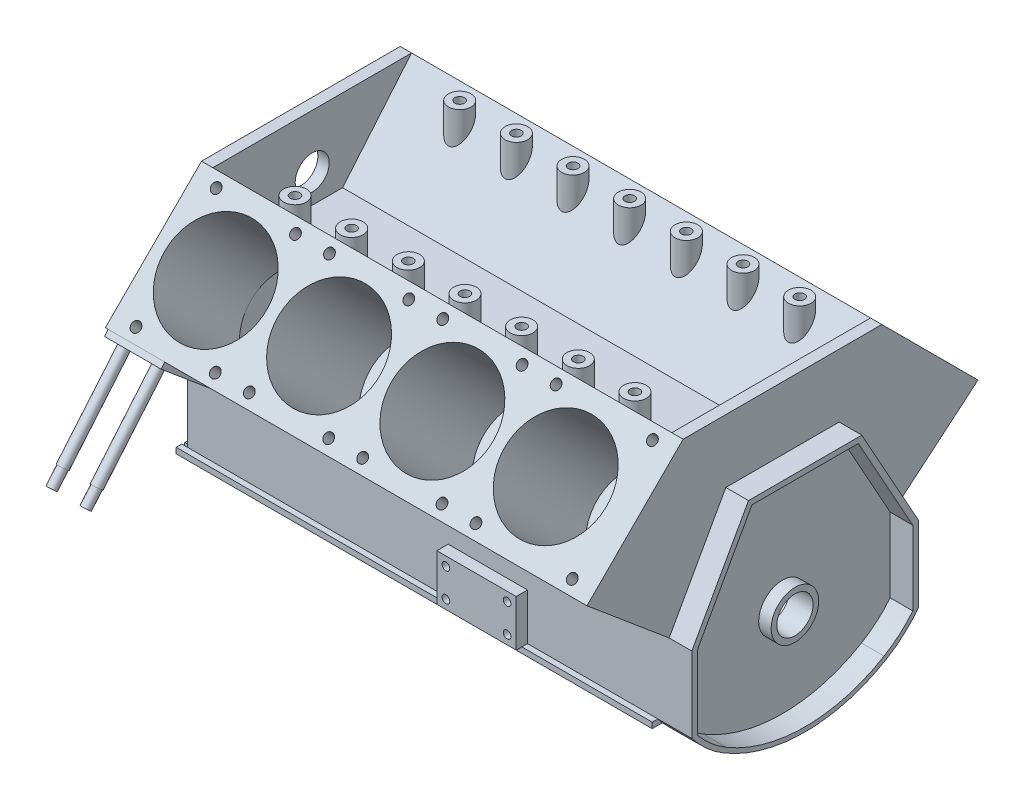
from build123d import *
from build123d.topology import SkipClean

# Parameters (mm, degrees)
BOSS_EXTRUDE1_DEPTH               = 255
BOSS_EXTRUDE1_DEPTH_BACK          = 170
SKETCH1_R                         = 16
CUT_EXTRUDE1_DEPTH                = 245
CUT_EXTRUDE1_DEPTH_BACK           = 160
SKETCH27_W                        = 15
SKETCH27_H                        = 300
BOSS_EXTRUDE10_DEPTH              = 140
BOSS_EXTRUDE10_2_DEPTH            = 140
BOSS_EXTRUDE10_3_DEPTH            = 140
SPLIT1_START                      = -150
SPLIT1_OUTLINE_W                  = 15
SPLIT1_OUTLINE_H                  = 140
SPLIT1_DEPTH                      = 50
SPLIT1_START_2                    = 100
SPLIT1_2_OUTLINE_W                = 15
SPLIT1_2_OUTLINE_H                = 140
SPLIT1_2_DEPTH                    = 50
SPLIT1_3_OUTLINE_W                = 15
SPLIT1_3_OUTLINE_H                = 140
SPLIT1_3_DEPTH                    = 50
SPLIT1_4_OUTLINE_W                = 15
SPLIT1_4_OUTLINE_H                = 140
SPLIT1_4_DEPTH                    = 50
SPLIT1_5_OUTLINE_W                = 15
SPLIT1_5_OUTLINE_H                = 140
SPLIT1_5_DEPTH                    = 50
SPLIT1_6_OUTLINE_W                = 15
SPLIT1_6_OUTLINE_H                = 140
SPLIT1_6_DEPTH                    = 50
SKETCH16_R                        = 21
SKETCH16_R_2                      = 16
BOSS_EXTRUDE5_DEPTH               = 11
BOSS_EXTRUDE6_DEPTH               = 10
BOSS_EXTRUDE7_START               = 5
SKETCH21_R                        = 22.5
SKETCH21_R_2                      = 16
BOSS_EXTRUDE7_DEPTH               = 5
CUT_EXTRUDE2_DEPTH                = 30
CUT_EXTRUDE2_DEPTH_BACK           = 20
BOSS_EXTRUDE8_DEPTH               = 5
BOSS_EXTRUDE12_DEPTH              = 5
CUT_EXTRUDE3_START                = 405
CUT_EXTRUDE3_DEPTH                = 405
TAP_DRILL_FOR_M8_TAP1_D           = 6.8
TAP_DRILL_FOR_M8_TAP1_DEPTH       = 10
TAP_DRILL_FOR_M8_TAP1_TIP         = 2.042926105
TAP_DRILL_FOR_M6_TAP1_D           = 5
TAP_DRILL_FOR_M6_TAP1_DEPTH       = 10
TAP_DRILL_FOR_M6_TAP1_TIP         = 1.502151548
SKETCH36_W                        = 175.362481734
SKETCH36_H                        = 92.53405461
BOSS_EXTRUDE13_DEPTH              = 10
SKETCH37_W                        = 175.362481734
SKETCH37_H                        = 92.53405461
SKETCH37_R                        = 15
BOSS_EXTRUDE14_DEPTH              = 10
TAP_DRILL_FOR_M5_TAP1_D           = 4.2
TAP_DRILL_FOR_M5_TAP1_DEPTH       = 10
TAP_DRILL_FOR_M5_TAP1_TIP         = 1.2618073
TAP_DRILL_FOR_M10_TAP1_D          = 8.5
TAP_DRILL_FOR_M10_TAP1_DEPTH      = 40
TAP_DRILL_FOR_M10_TAP1_TIP        = 2.553657631
TAP_DRILL_FOR_M10_TAP2_D          = 8.5
TAP_DRILL_FOR_M10_TAP2_DEPTH      = 40
TAP_DRILL_FOR_M10_TAP2_TIP        = 2.553657631
BOSS_EXTRUDE15_REACH              = 410.47
SKETCH47_R                        = 10
BOSS_EXTRUDE16_REACH              = 410.47
SKETCH52_R                        = 10
TAP_DRILL_FOR_M10_TAP4_AT_2_COUNT = 2
TAP_DRILL_FOR_M10_TAP4_AT_2_PITCH = 50
TAP_DRILL_FOR_M10_TAP4_AT_3_COUNT = 2
TAP_DRILL_FOR_M10_TAP4_AT_3_PITCH = 100
TAP_DRILL_FOR_M10_TAP4_AT_4_COUNT = 2
TAP_DRILL_FOR_M10_TAP4_AT_4_PITCH = 150
TAP_DRILL_FOR_M10_TAP4_AT_5_COUNT = 2
TAP_DRILL_FOR_M10_TAP4_AT_5_PITCH = 200
TAP_DRILL_FOR_M10_TAP4_AT_6_COUNT = 2
TAP_DRILL_FOR_M10_TAP4_AT_6_PITCH = 250
TAP_DRILL_FOR_M10_TAP4_AT_7_COUNT = 2
TAP_DRILL_FOR_M10_TAP4_AT_7_PITCH = 300
BOSS_EXTRUDE17_START              = 20
BOSS_EXTRUDE17_DEPTH              = 20
SKETCH54_R                        = 10
BOSS_EXTRUDE18_DEPTH              = 5
SKETCH55_R                        = 5
BOSS_EXTRUDE19_DEPTH              = 15
SKETCH56_W                        = 2.5
SKETCH56_H                        = 15.374670197
CUT_EXTRUDE4_DEPTH                = 508.504679815
TAP_DRILL_FOR_M6_TAP2_D           = 5
TAP_DRILL_FOR_M6_TAP2_DEPTH       = 10
TAP_DRILL_FOR_M6_TAP2_TIP         = 1.502151548
SKETCH60_W                        = 50
SKETCH60_H                        = 65
BOSS_EXTRUDE20_DEPTH              = 5
SKETCH61_R                        = 4.5
BOSS_EXTRUDE21_DEPTH              = 100
SKETCH62_OUTSIDE_W                = 601.06
SKETCH62_OUTSIDE_H                = 614.412
SKETCH62_OUTSIDE_R                = 4
CUT_EXTRUDE5_DEPTH                = 15
SKETCH63_W                        = 50
SKETCH63_H                        = 45
BOSS_EXTRUDE22_DEPTH              = 2.5
SKETCH64_R                        = 5
BOSS_EXTRUDE23_DEPTH              = 80
SKETCH65_OUTSIDE_W                = 612.408
SKETCH65_OUTSIDE_H                = 615.467
SKETCH65_OUTSIDE_R                = 4
CUT_EXTRUDE6_DEPTH                = 20
SKETCH66_W                        = 70
SKETCH66_H                        = 41
BOSS_EXTRUDE24_DEPTH              = 10
TAP_DRILL_FOR_M8_TAP2_AT_2_COUNT  = 2
TAP_DRILL_FOR_M8_TAP2_AT_2_PITCH  = 54
TAP_DRILL_FOR_M8_TAP2_AT_3_COUNT  = 2
TAP_DRILL_FOR_M8_TAP2_AT_3_PITCH  = 59.506302187
TAP_DRILL_FOR_M8_TAP2_AT_4_COUNT  = 2
TAP_DRILL_FOR_M8_TAP2_AT_4_PITCH  = 25


# Read off the part's stored shape, not the designer's step: Split1
with BuildPart() as part:
    # Sketch1 → Boss-Extrude1 (new, two sides: drawn at the far end of the back side and taken through both)
    with BuildSketch(Plane(origin=(0, 0, 0), x_dir=(0, 0, -1), z_dir=(1, 0, 0)).offset(-BOSS_EXTRUDE1_DEPTH_BACK)):
        Polygon((-87.681240867, 172.53405461), (-172.53405461, 87.681240867), (-100, 26.817942396), (-100, -40), (100, -40), (100, 26.817942396), (172.53405461, 87.681240867), (87.681240867, 172.53405461), (26.817942396, 100), (-26.817942396, 100), align=None)
        Circle(SKETCH1_R, mode=Mode.SUBTRACT)
    extrude(amount=BOSS_EXTRUDE1_DEPTH + BOSS_EXTRUDE1_DEPTH_BACK)

    # Sketch2 → Cut-Extrude1 (cut, two sides: drawn at the far end of the back side and taken through both)
    with BuildSketch(Plane(origin=(0, 0, 0), x_dir=(0, 0, -1), z_dir=(1, 0, 0)).offset(-CUT_EXTRUDE1_DEPTH_BACK)):
        Polygon((-90, -50), (-90, 18.426946085), (-18.426946085, 90), (18.426946085, 90), (90, 18.426946085), (90, -50), align=None)
    extrude(amount=CUT_EXTRUDE1_DEPTH + CUT_EXTRUDE1_DEPTH_BACK, mode=Mode.SUBTRACT)


with BuildPart() as body_2:
    # Sketch27 → Boss-Extrude10 (new body)
    with BuildSketch(Plane.XZ.offset(40)):
        with Locations((-57.5, 0)):
            Rectangle(SKETCH27_W, SKETCH27_H)
    extrude(amount=-BOSS_EXTRUDE10_DEPTH)

    # Split1 outline → Split1 (cut)
    with BuildSketch(Plane.XY.offset(SPLIT1_START)):
        with Locations((-57.5, 30)):
            Rectangle(SPLIT1_OUTLINE_W, SPLIT1_OUTLINE_H)
    extrude(amount=SPLIT1_DEPTH, mode=Mode.SUBTRACT)

    # Split1 2 outline → Split1 2 (cut)
    with BuildSketch(Plane.XY.offset(SPLIT1_START_2)):
        with Locations((-57.5, 30)):
            Rectangle(SPLIT1_2_OUTLINE_W, SPLIT1_2_OUTLINE_H)
    extrude(amount=SPLIT1_2_DEPTH, mode=Mode.SUBTRACT)


with BuildPart() as body_3:
    # Sketch27 → Boss-Extrude10 2 (new body)
    with BuildSketch(Plane.XZ.offset(40)):
        with Locations((42.5, 0)):
            Rectangle(SKETCH27_W, SKETCH27_H)
    extrude(amount=-BOSS_EXTRUDE10_2_DEPTH)

    # Split1 3 outline → Split1 3 (cut)
    with BuildSketch(Plane.XY.offset(SPLIT1_START)):
        with Locations((42.5, 30)):
            Rectangle(SPLIT1_3_OUTLINE_W, SPLIT1_3_OUTLINE_H)
    extrude(amount=SPLIT1_3_DEPTH, mode=Mode.SUBTRACT)

    # Split1 4 outline → Split1 4 (cut)
    with BuildSketch(Plane.XY.offset(SPLIT1_START_2)):
        with Locations((42.5, 30)):
            Rectangle(SPLIT1_4_OUTLINE_W, SPLIT1_4_OUTLINE_H)
    extrude(amount=SPLIT1_4_DEPTH, mode=Mode.SUBTRACT)


with BuildPart() as body_4:
    # Sketch27 → Boss-Extrude10 3 (new body)
    with BuildSketch(Plane.XZ.offset(40)):
        with Locations((142.5, 0)):
            Rectangle(SKETCH27_W, SKETCH27_H)
    extrude(amount=-BOSS_EXTRUDE10_3_DEPTH)

    # Split1 5 outline → Split1 5 (cut)
    with BuildSketch(Plane.XY.offset(SPLIT1_START)):
        with Locations((142.5, 30)):
            Rectangle(SPLIT1_5_OUTLINE_W, SPLIT1_5_OUTLINE_H)
    extrude(amount=SPLIT1_5_DEPTH, mode=Mode.SUBTRACT)

    # Split1 6 outline → Split1 6 (cut)
    with BuildSketch(Plane.XY.offset(SPLIT1_START_2)):
        with Locations((142.5, 30)):
            Rectangle(SPLIT1_6_OUTLINE_W, SPLIT1_6_OUTLINE_H)
    extrude(amount=SPLIT1_6_DEPTH, mode=Mode.SUBTRACT)


with BuildPart() as part_1:
    add(part.part)

    # Combine1: union body 4, body 3, body 2
    add(body_4.part)
    add(body_3.part)
    add(body_2.part)

    # Sketch3 → Cut-Revolve1 (revolve, cut)
    with BuildSketch(Plane(origin=(-115, 0, 0), x_dir=(0, 0, -1), z_dir=(1, 0, 0)), mode=Mode.PRIVATE) as cut_revolve1_sk:
        Polygon((-98.287842585, 161.927452892), (-16.970562748, 80.610173055), (-48.790367902, 48.790367902), (-130.107647738, 130.107647738), align=None)
    revolve(cut_revolve1_sk.sketch.rotate(Axis((-115, 130.107647738, 130.107647738), (0, -0.7071067811865525, -0.7071067811865427)), 180), axis=Axis((-115, 130.107647738, 130.107647738), (0, -0.7071067811865525, -0.7071067811865427)), mode=Mode.SUBTRACT)

    # Sketch4 → Cut-Revolve2 (revolve, cut)
    with BuildSketch(Plane(origin=(-15, 0, 0), x_dir=(0, 0, -1), z_dir=(1, 0, 0)), mode=Mode.PRIVATE) as cut_revolve2_sk:
        Polygon((-98.287842585, 161.927452892), (-130.107647738, 130.107647738), (-48.790367902, 48.790367902), (-16.970562748, 80.610173055), align=None)
    revolve(cut_revolve2_sk.sketch.rotate(Axis((-15, 130.107647738, 130.107647738), (0, -0.7071067811865525, -0.7071067811865427)), 180), axis=Axis((-15, 130.107647738, 130.107647738), (0, -0.7071067811865525, -0.7071067811865427)), mode=Mode.SUBTRACT)

    # Sketch5 → Cut-Revolve3 (revolve, cut)
    with BuildSketch(Plane(origin=(85, 0, 0), x_dir=(0, 0, -1), z_dir=(1, 0, 0)), mode=Mode.PRIVATE) as cut_revolve3_sk:
        Polygon((-98.287842585, 161.927452892), (-130.107647738, 130.107647738), (-48.790367902, 48.790367902), (-16.970562748, 80.610173055), align=None)
    revolve(cut_revolve3_sk.sketch.rotate(Axis((85, 130.107647738, 130.107647738), (0, -0.7071067811865525, -0.7071067811865427)), 180), axis=Axis((85, 130.107647738, 130.107647738), (0, -0.7071067811865525, -0.7071067811865427)), mode=Mode.SUBTRACT)

    # Sketch6 → Cut-Revolve4 (revolve, cut)
    with BuildSketch(Plane(origin=(185, 0, 0), x_dir=(0, 0, -1), z_dir=(1, 0, 0))):
        Polygon((-16.970562748, 80.610173055), (-48.790367902, 48.790367902), (-130.107647738, 130.107647738), (-98.287842585, 161.927452892), align=None)
    revolve(axis=Axis((185, 48.790367902, 48.790367902), (0, 0.7071067811865525, 0.7071067811865427)), mode=Mode.SUBTRACT)

    # Sketch7 → Cut-Revolve5 (revolve, cut)
    with BuildSketch(Plane(origin=(0, 0, 0), x_dir=(0, 0, -1), z_dir=(1, 0, 0))):
        Polygon((130.107647738, 130.107647738), (48.790367902, 48.790367902), (16.970562748, 80.610173055), (98.287842585, 161.927452892), align=None)
    revolve(axis=Axis((0, 130.107647738, -130.107647738), (0, -0.7071067811865439, 0.7071067811865512)), mode=Mode.SUBTRACT)

    # Sketch8 → Cut-Revolve6 (revolve, cut)
    with BuildSketch(Plane(origin=(-100, 0, 0), x_dir=(0, 0, -1), z_dir=(1, 0, 0)), mode=Mode.PRIVATE) as cut_revolve6_sk:
        Polygon((130.107647738, 130.107647738), (98.287842585, 161.927452892), (16.970562748, 80.610173055), (48.790367902, 48.790367902), align=None)
    revolve(cut_revolve6_sk.sketch.rotate(Axis((-100, 48.790367902, -48.790367902), (0, 0.7071067811865439, -0.7071067811865512)), 180), axis=Axis((-100, 48.790367902, -48.790367902), (0, 0.7071067811865439, -0.7071067811865512)), mode=Mode.SUBTRACT)

    # Sketch9 → Cut-Revolve7 (revolve, cut)
    with BuildSketch(Plane(origin=(100, 0, 0), x_dir=(0, 0, -1), z_dir=(1, 0, 0)), mode=Mode.PRIVATE) as cut_revolve7_sk:
        Polygon((130.107647738, 130.107647738), (98.287842585, 161.927452892), (16.970562748, 80.610173055), (48.790367902, 48.790367902), align=None)
    revolve(cut_revolve7_sk.sketch.rotate(Axis((100, 48.790367902, -48.790367902), (0, 0.7071067811865439, -0.7071067811865512)), 180), axis=Axis((100, 48.790367902, -48.790367902), (0, 0.7071067811865439, -0.7071067811865512)), mode=Mode.SUBTRACT)

    # Sketch10 → Cut-Revolve8 (revolve, cut)
    with BuildSketch(Plane(origin=(200, 0, 0), x_dir=(0, 0, -1), z_dir=(1, 0, 0)), mode=Mode.PRIVATE) as cut_revolve8_sk:
        Polygon((130.107647738, 130.107647738), (98.287842585, 161.927452892), (16.970562748, 80.610173055), (48.790367902, 48.790367902), align=None)
    revolve(cut_revolve8_sk.sketch.rotate(Axis((200, 48.790367902, -48.790367902), (0, 0.7071067811865439, -0.7071067811865512)), 180), axis=Axis((200, 48.790367902, -48.790367902), (0, 0.7071067811865439, -0.7071067811865512)), mode=Mode.SUBTRACT)

    # Sketch16 → Boss-Extrude5 (add)
    with BuildSketch(Plane.ZY.offset(-255)):
        Circle(SKETCH16_R)
        Circle(SKETCH16_R_2, mode=Mode.SUBTRACT)
    extrude(amount=-BOSS_EXTRUDE5_DEPTH)

    # Sketch19 → Boss-Extrude6 (add)
    with BuildSketch(Plane(origin=(255, 0, 0), x_dir=(0, 0, -1), z_dir=(1, 0, 0))):
        with BuildLine():
            Line((-100, -40), (100, -40))
            ThreePointArc((100, -40), (87.061524379, -53.973509292), (71.708679638, -65.240863539))
            ThreePointArc((71.708679638, -65.240863539), (0, -85), (-71.708679638, -65.240863539))
            ThreePointArc((-71.708679638, -65.240863539), (-87.061524379, -53.973509292), (-100, -40))
        make_face()
    extrude(amount=-BOSS_EXTRUDE6_DEPTH)

    # Sketch21 → Boss-Extrude7 (add)
    with BuildSketch(Plane.ZY.offset(170).offset(BOSS_EXTRUDE7_START)):
        Circle(SKETCH21_R)
        Circle(SKETCH21_R_2, mode=Mode.SUBTRACT)
    extrude(amount=-BOSS_EXTRUDE7_DEPTH)

    # Sketch20 → Cut-Extrude2 (cut, two sides: drawn at the far end of the back side and taken through both)
    with SkipClean():  # the faces are left unmerged after this step: merging them gives an invalid solid
        with BuildSketch(Plane.ZY.offset(170).offset(-CUT_EXTRUDE2_DEPTH_BACK)):
            Polygon((0, 0), (-35, 0), (-35, -42.052319265), (35, -42.052319265), (35, 0), align=None)
        extrude(amount=CUT_EXTRUDE2_DEPTH + CUT_EXTRUDE2_DEPTH_BACK, mode=Mode.SUBTRACT)
    add(part_1.part.scale(1), mode=Mode.REPLACE)  # the faces are merged on a copy

    # Sketch22 → Boss-Extrude8 (add)
    with BuildSketch(Plane.ZY.offset(170)):
        Polygon((-16, 0), (-35, 0), (-35, -40), (-40, -40), (-40, 5), (-16, 5), align=None)
        Polygon((16, 5), (16, 0), (35, 0), (35, -40), (40, -40), (40, 5), align=None)
    extrude(amount=BOSS_EXTRUDE8_DEPTH)

    # Sketch23 → Boss-Extrude12 (add)
    with BuildSketch(Plane.XZ.offset(40)):
        Polygon((-175, 105), (245, 105), (245, -105), (-175, -105), (-175, -35), (-150, -35), (-150, -80), (230, -80), (230, 80), (-150, 80), (-150, 35), (-175, 35), align=None)
    extrude(amount=BOSS_EXTRUDE12_DEPTH)

    # Sketch28 → Cut-Extrude3 (cut)
    with BuildSketch(Plane.ZY.offset(-245).offset(CUT_EXTRUDE3_START)):
        with BuildLine():
            Line((90, -40), (90, 0))
            Line((90, 0), (16, 0))
            ThreePointArc((16, 0), (0, 16), (-16, 0))
            Line((-16, 0), (-90, 0))
            Line((-90, 0), (-90, -40))
            Line((-90, -40), (90, -40))
        make_face()
    extrude(amount=-CUT_EXTRUDE3_DEPTH, mode=Mode.SUBTRACT)

    # Tap Drill for M8 Tap1
    with Locations(Plane(origin=(0, 0, 0), x_dir=(-1, 0, 0), z_dir=(0, -1, 0))):
        with Locations((57.5, -26.25), (57.5, 26.25), (-42.5, -26.25), (-42.5, 26.25), (-142.5, 26.25), (-142.5, -26.25)):
            Hole(TAP_DRILL_FOR_M8_TAP1_D / 2, depth=TAP_DRILL_FOR_M8_TAP1_DEPTH)
            with Locations((0, 0, -(TAP_DRILL_FOR_M8_TAP1_DEPTH + TAP_DRILL_FOR_M8_TAP1_TIP / 2))):  # 118° drill point
                Cone(0, TAP_DRILL_FOR_M8_TAP1_D / 2, TAP_DRILL_FOR_M8_TAP1_TIP, mode=Mode.SUBTRACT)

    # Tap Drill for M6 Tap1
    with Locations(Plane(origin=(0, -45, 0), x_dir=(-1, 0, 0), z_dir=(0, -1, 0))):
        with Locations((165, -95), (65, -95), (-35, -95), (-135, -95), (-235, -95), (165, 95), (65, 95), (-35, 95), (-135, 95), (-235, 95)):
            Hole(TAP_DRILL_FOR_M6_TAP1_D / 2, depth=TAP_DRILL_FOR_M6_TAP1_DEPTH)
            with Locations((0, 0, -(TAP_DRILL_FOR_M6_TAP1_DEPTH + TAP_DRILL_FOR_M6_TAP1_TIP / 2))):  # 118° drill point
                Cone(0, TAP_DRILL_FOR_M6_TAP1_D / 2, TAP_DRILL_FOR_M6_TAP1_TIP, mode=Mode.SUBTRACT)

    # Sketch36 → Boss-Extrude13 (add)
    with BuildSketch(Plane(origin=(255, 0, 0), x_dir=(0, 0, -1), z_dir=(1, 0, 0))):
        with Locations((0, 126.267027305)):
            Rectangle(SKETCH36_W, SKETCH36_H)
    extrude(amount=-BOSS_EXTRUDE13_DEPTH)

    # Sketch37 → Boss-Extrude14 (add)
    with BuildSketch(Plane.ZY.offset(170)):
        with Locations((0, 126.267027305)):
            Rectangle(SKETCH37_W, SKETCH37_H)
        with Locations((0, 125)):
            Circle(SKETCH37_R, mode=Mode.SUBTRACT)
    extrude(amount=-BOSS_EXTRUDE14_DEPTH)

    # Tap Drill for M5 Tap1
    with Locations(Plane(origin=(0, 0, 0), x_dir=(-1, 0, 0), z_dir=(0, -1, 0))):
        with Locations((165, -27), (165, 27)):
            Hole(TAP_DRILL_FOR_M5_TAP1_D / 2, depth=TAP_DRILL_FOR_M5_TAP1_DEPTH)
            with Locations((0, 0, -(TAP_DRILL_FOR_M5_TAP1_DEPTH + TAP_DRILL_FOR_M5_TAP1_TIP / 2))):  # 118° drill point
                Cone(0, TAP_DRILL_FOR_M5_TAP1_D / 2, TAP_DRILL_FOR_M5_TAP1_TIP, mode=Mode.SUBTRACT)

    # Tap Drill for M10 Tap1
    with Locations(Plane(origin=(0, 130.107647738, -130.107647738), x_dir=(-1, 0, 0), z_dir=(0, 0.7071067811865438, -0.7071067811865513))):
        with Locations((150, -50), (150, 50), (65, -50), (65, 50), (-235, -50), (-235, 50), (35, -50), (35, 50), (-35, 50), (-35, -50), (-65, -50), (-65, 50), (-135, 50), (-135, -50), (-165, -50), (-165, 50)):
            Hole(TAP_DRILL_FOR_M10_TAP1_D / 2, depth=TAP_DRILL_FOR_M10_TAP1_DEPTH)
            with Locations((0, 0, -(TAP_DRILL_FOR_M10_TAP1_DEPTH + TAP_DRILL_FOR_M10_TAP1_TIP / 2))):  # 118° drill point
                Cone(0, TAP_DRILL_FOR_M10_TAP1_D / 2, TAP_DRILL_FOR_M10_TAP1_TIP, mode=Mode.SUBTRACT)

    # Tap Drill for M10 Tap2
    with Locations(Plane(origin=(0, 130.107647738, 130.107647738), x_dir=(1, 0, 0), z_dir=(0, 0.7071067811865575, 0.7071067811865377))):
        with Locations((-150, 50), (-80, 50), (-50, 50), (20, 50), (50, 50), (120, 50), (150, 50), (235, 50), (235, -50), (150, -50), (120, -50), (50, -50), (20, -50), (-50, -50), (-80, -50), (-150, -50)):
            Hole(TAP_DRILL_FOR_M10_TAP2_D / 2, depth=TAP_DRILL_FOR_M10_TAP2_DEPTH)
            with Locations((0, 0, -(TAP_DRILL_FOR_M10_TAP2_DEPTH + TAP_DRILL_FOR_M10_TAP2_TIP / 2))):  # 118° drill point
                Cone(0, TAP_DRILL_FOR_M10_TAP2_D / 2, TAP_DRILL_FOR_M10_TAP2_TIP, mode=Mode.SUBTRACT)

    # Boss-Extrude15: up to this plane
    boss_extrude15_end = Plane(origin=(-170, 100, -26.817942396), z_dir=(0, 0.6427876096865541, 0.7660444431189657))
    # Sketch47 → Boss-Extrude15 (add, up to the surface)
    with BuildSketch(Plane(origin=(0, 172.53405461, 0), x_dir=(1, 0, 0), z_dir=(0, 1, 0)), mode=Mode.PRIVATE) as boss_extrude15_sk1:
        with Locations(Location((-102.5, 72.681240867, 0), (0, 0, 270))):
            Circle(SKETCH47_R)
    boss_extrude15_tool1 = split(extrude(boss_extrude15_sk1.sketch, amount=-BOSS_EXTRUDE15_REACH, mode=Mode.PRIVATE), bisect_by=boss_extrude15_end, keep=Keep.BOTH, mode=Mode.PRIVATE)
    add(boss_extrude15_tool1.solids().sort_by_distance((-102.5, 172.534055, -72.681241))[0])
    # Sketch47 → Boss-Extrude15 (add, up to the surface)
    with BuildSketch(Plane(origin=(0, 172.53405461, 0), x_dir=(1, 0, 0), z_dir=(0, 1, 0)), mode=Mode.PRIVATE) as boss_extrude15_sk2:
        with Locations(Location((-52.5, 72.681240867, 0), (0, 0, 270))):
            Circle(SKETCH47_R)
    boss_extrude15_tool2 = split(extrude(boss_extrude15_sk2.sketch, amount=-BOSS_EXTRUDE15_REACH, mode=Mode.PRIVATE), bisect_by=boss_extrude15_end, keep=Keep.BOTH, mode=Mode.PRIVATE)
    add(boss_extrude15_tool2.solids().sort_by_distance((-52.5, 172.534055, -72.681241))[0])
    # Sketch47 → Boss-Extrude15 (add, up to the surface)
    with BuildSketch(Plane(origin=(0, 172.53405461, 0), x_dir=(1, 0, 0), z_dir=(0, 1, 0)), mode=Mode.PRIVATE) as boss_extrude15_sk3:
        with Locations(Location((-2.5, 72.681240867, 0), (0, 0, 270))):
            Circle(SKETCH47_R)
    boss_extrude15_tool3 = split(extrude(boss_extrude15_sk3.sketch, amount=-BOSS_EXTRUDE15_REACH, mode=Mode.PRIVATE), bisect_by=boss_extrude15_end, keep=Keep.BOTH, mode=Mode.PRIVATE)
    add(boss_extrude15_tool3.solids().sort_by_distance((-2.5, 172.534055, -72.681241))[0])
    # Sketch47 → Boss-Extrude15 (add, up to the surface)
    with BuildSketch(Plane(origin=(0, 172.53405461, 0), x_dir=(1, 0, 0), z_dir=(0, 1, 0)), mode=Mode.PRIVATE) as boss_extrude15_sk4:
        with Locations(Location((47.5, 72.681240867, 0), (0, 0, 270))):
            Circle(SKETCH47_R)
    boss_extrude15_tool4 = split(extrude(boss_extrude15_sk4.sketch, amount=-BOSS_EXTRUDE15_REACH, mode=Mode.PRIVATE), bisect_by=boss_extrude15_end, keep=Keep.BOTH, mode=Mode.PRIVATE)
    add(boss_extrude15_tool4.solids().sort_by_distance((47.5, 172.534055, -72.681241))[0])
    # Sketch47 → Boss-Extrude15 (add, up to the surface)
    with BuildSketch(Plane(origin=(0, 172.53405461, 0), x_dir=(1, 0, 0), z_dir=(0, 1, 0)), mode=Mode.PRIVATE) as boss_extrude15_sk5:
        with Locations(Location((97.5, 72.681240867, 0), (0, 0, 270))):
            Circle(SKETCH47_R)
    boss_extrude15_tool5 = split(extrude(boss_extrude15_sk5.sketch, amount=-BOSS_EXTRUDE15_REACH, mode=Mode.PRIVATE), bisect_by=boss_extrude15_end, keep=Keep.BOTH, mode=Mode.PRIVATE)
    add(boss_extrude15_tool5.solids().sort_by_distance((97.5, 172.534055, -72.681241))[0])
    # Sketch47 → Boss-Extrude15 (add, up to the surface)
    with BuildSketch(Plane(origin=(0, 172.53405461, 0), x_dir=(1, 0, 0), z_dir=(0, 1, 0)), mode=Mode.PRIVATE) as boss_extrude15_sk6:
        with Locations(Location((147.5, 72.681240867, 0), (0, 0, 270))):
            Circle(SKETCH47_R)
    boss_extrude15_tool6 = split(extrude(boss_extrude15_sk6.sketch, amount=-BOSS_EXTRUDE15_REACH, mode=Mode.PRIVATE), bisect_by=boss_extrude15_end, keep=Keep.BOTH, mode=Mode.PRIVATE)
    add(boss_extrude15_tool6.solids().sort_by_distance((147.5, 172.534055, -72.681241))[0])
    # Sketch47 → Boss-Extrude15 (add, up to the surface)
    with BuildSketch(Plane(origin=(0, 172.53405461, 0), x_dir=(1, 0, 0), z_dir=(0, 1, 0)), mode=Mode.PRIVATE) as boss_extrude15_sk7:
        with Locations(Location((197.5, 72.681240867, 0), (0, 0, 270))):
            Circle(SKETCH47_R)
    boss_extrude15_tool7 = split(extrude(boss_extrude15_sk7.sketch, amount=-BOSS_EXTRUDE15_REACH, mode=Mode.PRIVATE), bisect_by=boss_extrude15_end, keep=Keep.BOTH, mode=Mode.PRIVATE)
    add(boss_extrude15_tool7.solids().sort_by_distance((197.5, 172.534055, -72.681241))[0])

    # Boss-Extrude16: up to this plane
    boss_extrude16_end = Plane(origin=(-170, 172.53405461, 87.681240867), z_dir=(0, 0.6427876096865339, -0.7660444431189827))
    # Sketch52 → Boss-Extrude16 (add, up to the surface)
    with BuildSketch(Plane(origin=(0, 172.53405461, 0), x_dir=(1, 0, 0), z_dir=(0, 1, 0)), mode=Mode.PRIVATE) as boss_extrude16_sk1:
        with Locations(Location((-102.5, -72.681240867, 0), (0, 0, 270))):
            Circle(SKETCH52_R)
    boss_extrude16_tool1 = split(extrude(boss_extrude16_sk1.sketch, amount=-BOSS_EXTRUDE16_REACH, mode=Mode.PRIVATE), bisect_by=boss_extrude16_end, keep=Keep.BOTH, mode=Mode.PRIVATE)
    add(boss_extrude16_tool1.solids().sort_by_distance((-102.5, 172.534055, 72.681241))[0])
    # Sketch52 → Boss-Extrude16 (add, up to the surface)
    with BuildSketch(Plane(origin=(0, 172.53405461, 0), x_dir=(1, 0, 0), z_dir=(0, 1, 0)), mode=Mode.PRIVATE) as boss_extrude16_sk2:
        with Locations(Location((-52.5, -72.681240867, 0), (0, 0, 270))):
            Circle(SKETCH52_R)
    boss_extrude16_tool2 = split(extrude(boss_extrude16_sk2.sketch, amount=-BOSS_EXTRUDE16_REACH, mode=Mode.PRIVATE), bisect_by=boss_extrude16_end, keep=Keep.BOTH, mode=Mode.PRIVATE)
    add(boss_extrude16_tool2.solids().sort_by_distance((-52.5, 172.534055, 72.681241))[0])
    # Sketch52 → Boss-Extrude16 (add, up to the surface)
    with BuildSketch(Plane(origin=(0, 172.53405461, 0), x_dir=(1, 0, 0), z_dir=(0, 1, 0)), mode=Mode.PRIVATE) as boss_extrude16_sk3:
        with Locations(Location((-2.5, -72.681240867, 0), (0, 0, 270))):
            Circle(SKETCH52_R)
    boss_extrude16_tool3 = split(extrude(boss_extrude16_sk3.sketch, amount=-BOSS_EXTRUDE16_REACH, mode=Mode.PRIVATE), bisect_by=boss_extrude16_end, keep=Keep.BOTH, mode=Mode.PRIVATE)
    add(boss_extrude16_tool3.solids().sort_by_distance((-2.5, 172.534055, 72.681241))[0])
    # Sketch52 → Boss-Extrude16 (add, up to the surface)
    with BuildSketch(Plane(origin=(0, 172.53405461, 0), x_dir=(1, 0, 0), z_dir=(0, 1, 0)), mode=Mode.PRIVATE) as boss_extrude16_sk4:
        with Locations(Location((47.5, -72.681240867, 0), (0, 0, 270))):
            Circle(SKETCH52_R)
    boss_extrude16_tool4 = split(extrude(boss_extrude16_sk4.sketch, amount=-BOSS_EXTRUDE16_REACH, mode=Mode.PRIVATE), bisect_by=boss_extrude16_end, keep=Keep.BOTH, mode=Mode.PRIVATE)
    add(boss_extrude16_tool4.solids().sort_by_distance((47.5, 172.534055, 72.681241))[0])
    # Sketch52 → Boss-Extrude16 (add, up to the surface)
    with BuildSketch(Plane(origin=(0, 172.53405461, 0), x_dir=(1, 0, 0), z_dir=(0, 1, 0)), mode=Mode.PRIVATE) as boss_extrude16_sk5:
        with Locations(Location((97.5, -72.681240867, 0), (0, 0, 270))):
            Circle(SKETCH52_R)
    boss_extrude16_tool5 = split(extrude(boss_extrude16_sk5.sketch, amount=-BOSS_EXTRUDE16_REACH, mode=Mode.PRIVATE), bisect_by=boss_extrude16_end, keep=Keep.BOTH, mode=Mode.PRIVATE)
    add(boss_extrude16_tool5.solids().sort_by_distance((97.5, 172.534055, 72.681241))[0])
    # Sketch52 → Boss-Extrude16 (add, up to the surface)
    with BuildSketch(Plane(origin=(0, 172.53405461, 0), x_dir=(1, 0, 0), z_dir=(0, 1, 0)), mode=Mode.PRIVATE) as boss_extrude16_sk6:
        with Locations(Location((147.5, -72.681240867, 0), (0, 0, 270))):
            Circle(SKETCH52_R)
    boss_extrude16_tool6 = split(extrude(boss_extrude16_sk6.sketch, amount=-BOSS_EXTRUDE16_REACH, mode=Mode.PRIVATE), bisect_by=boss_extrude16_end, keep=Keep.BOTH, mode=Mode.PRIVATE)
    add(boss_extrude16_tool6.solids().sort_by_distance((147.5, 172.534055, 72.681241))[0])
    # Sketch52 → Boss-Extrude16 (add, up to the surface)
    with BuildSketch(Plane(origin=(0, 172.53405461, 0), x_dir=(1, 0, 0), z_dir=(0, 1, 0)), mode=Mode.PRIVATE) as boss_extrude16_sk7:
        with Locations(Location((197.5, -72.681240867, 0), (0, 0, 270))):
            Circle(SKETCH52_R)
    boss_extrude16_tool7 = split(extrude(boss_extrude16_sk7.sketch, amount=-BOSS_EXTRUDE16_REACH, mode=Mode.PRIVATE), bisect_by=boss_extrude16_end, keep=Keep.BOTH, mode=Mode.PRIVATE)
    add(boss_extrude16_tool7.solids().sort_by_distance((197.5, 172.534055, 72.681241))[0])

    # Sketch51 → Tap Drill for M10 Tap4 (revolve, cut)
    with BuildSketch(Plane(origin=(-102.5, 172.53405461, -72.681240867), x_dir=(0, 0, 1), z_dir=(1, 0, 0))):
        Polygon((0, 0), (0, 22.553657631), (4.25, 20), (4.25, 0), align=None)
    tap_drill_for_m10_tap4 = revolve(axis=Axis((-102.5, 178.88405461, -72.681240867), (0, -1, 0)), mode=Mode.SUBTRACT)

    # Tap Drill for M10 Tap4 at 2: Tap Drill for M10 Tap4 ×2
    with Locations(*[(i * TAP_DRILL_FOR_M10_TAP4_AT_2_PITCH, 0, 0) for i in range(1, TAP_DRILL_FOR_M10_TAP4_AT_2_COUNT)]):
        add(tap_drill_for_m10_tap4, mode=Mode.SUBTRACT)

    # Tap Drill for M10 Tap4 at 3: Tap Drill for M10 Tap4 ×2
    with Locations(*[(i * TAP_DRILL_FOR_M10_TAP4_AT_3_PITCH, 0, 0) for i in range(1, TAP_DRILL_FOR_M10_TAP4_AT_3_COUNT)]):
        add(tap_drill_for_m10_tap4, mode=Mode.SUBTRACT)

    # Tap Drill for M10 Tap4 at 4: Tap Drill for M10 Tap4 ×2
    with Locations(*[(i * TAP_DRILL_FOR_M10_TAP4_AT_4_PITCH, 0, 0) for i in range(1, TAP_DRILL_FOR_M10_TAP4_AT_4_COUNT)]):
        add(tap_drill_for_m10_tap4, mode=Mode.SUBTRACT)

    # Tap Drill for M10 Tap4 at 5: Tap Drill for M10 Tap4 ×2
    with Locations(*[(i * TAP_DRILL_FOR_M10_TAP4_AT_5_PITCH, 0, 0) for i in range(1, TAP_DRILL_FOR_M10_TAP4_AT_5_COUNT)]):
        add(tap_drill_for_m10_tap4, mode=Mode.SUBTRACT)

    # Tap Drill for M10 Tap4 at 6: Tap Drill for M10 Tap4 ×2
    with Locations(*[(i * TAP_DRILL_FOR_M10_TAP4_AT_6_PITCH, 0, 0) for i in range(1, TAP_DRILL_FOR_M10_TAP4_AT_6_COUNT)]):
        add(tap_drill_for_m10_tap4, mode=Mode.SUBTRACT)

    # Tap Drill for M10 Tap4 at 7: Tap Drill for M10 Tap4 ×2
    with Locations(*[(i * TAP_DRILL_FOR_M10_TAP4_AT_7_PITCH, 0, 0) for i in range(1, TAP_DRILL_FOR_M10_TAP4_AT_7_COUNT)]):
        add(tap_drill_for_m10_tap4, mode=Mode.SUBTRACT)

    # Mirror1: Tap Drill for M10 Tap4 across plane
    add(tap_drill_for_m10_tap4.mirror(Plane.XY), mode=Mode.SUBTRACT)

    # Mirror1 copy 1 sketch → Mirror1 copy 1 (revolve, cut)
    with BuildSketch(Plane(origin=(-52.5, 172.53405461, 72.681240867), x_dir=(0, 0, -1), z_dir=(1, 0, 0))):
        Polygon((0, 0), (0, -22.553657631), (4.25, -20), (4.25, 0), align=None)
    revolve(axis=Axis((-52.5, 178.88405461, 72.681240867), (0, 1, 0)), mode=Mode.SUBTRACT)

    # Mirror1 copy 2 sketch → Mirror1 copy 2 (revolve, cut)
    with BuildSketch(Plane(origin=(-2.5, 172.53405461, 72.681240867), x_dir=(0, 0, -1), z_dir=(1, 0, 0))):
        Polygon((0, 0), (0, -22.553657631), (4.25, -20), (4.25, 0), align=None)
    revolve(axis=Axis((-2.5, 178.88405461, 72.681240867), (0, 1, 0)), mode=Mode.SUBTRACT)

    # Mirror1 copy 3 sketch → Mirror1 copy 3 (revolve, cut)
    with BuildSketch(Plane(origin=(47.5, 172.53405461, 72.681240867), x_dir=(0, 0, -1), z_dir=(1, 0, 0))):
        Polygon((0, 0), (0, -22.553657631), (4.25, -20), (4.25, 0), align=None)
    revolve(axis=Axis((47.5, 178.88405461, 72.681240867), (0, 1, 0)), mode=Mode.SUBTRACT)

    # Mirror1 copy 4 sketch → Mirror1 copy 4 (revolve, cut)
    with BuildSketch(Plane(origin=(97.5, 172.53405461, 72.681240867), x_dir=(0, 0, -1), z_dir=(1, 0, 0))):
        Polygon((0, 0), (0, -22.553657631), (4.25, -20), (4.25, 0), align=None)
    revolve(axis=Axis((97.5, 178.88405461, 72.681240867), (0, 1, 0)), mode=Mode.SUBTRACT)

    # Mirror1 copy 5 sketch → Mirror1 copy 5 (revolve, cut)
    with BuildSketch(Plane(origin=(147.5, 172.53405461, 72.681240867), x_dir=(0, 0, -1), z_dir=(1, 0, 0))):
        Polygon((0, 0), (0, -22.553657631), (4.25, -20), (4.25, 0), align=None)
    revolve(axis=Axis((147.5, 178.88405461, 72.681240867), (0, 1, 0)), mode=Mode.SUBTRACT)

    # Mirror1 copy 6 sketch → Mirror1 copy 6 (revolve, cut)
    with BuildSketch(Plane(origin=(197.5, 172.53405461, 72.681240867), x_dir=(0, 0, -1), z_dir=(1, 0, 0))):
        Polygon((0, 0), (0, -22.553657631), (4.25, -20), (4.25, 0), align=None)
    revolve(axis=Axis((197.5, 178.88405461, 72.681240867), (0, 1, 0)), mode=Mode.SUBTRACT)

    # Sketch53 → Boss-Extrude17 (add)
    with BuildSketch(Plane(origin=(255, 0, 0), x_dir=(0, 0, -1), z_dir=(1, 0, 0)).offset(BOSS_EXTRUDE17_START)):
        with BuildLine():
            Line((-100, -40), (-100, 26.817942396))
            Line((-100, 26.817942396), (-50, 116.817942396))
            Line((-50, 116.817942396), (50, 116.817942396))
            Line((50, 116.817942396), (100, 26.817942396))
            Line((100, 26.817942396), (100, -40))
            ThreePointArc((100, -40), (87.061524379, -53.973509292), (71.708679638, -65.240863539))
            ThreePointArc((71.708679638, -65.240863539), (0, -85), (-71.708679638, -65.240863539))
            ThreePointArc((-71.708679638, -65.240863539), (-87.061524379, -53.973509292), (-100, -40))
        make_face()
        with BuildLine():
            Line((-95, 25.522312256), (-46.954785826, 112.003697769))
            Line((-46.954785826, 112.003697769), (46.954785826, 112.003697769))
            Line((46.954785826, 112.003697769), (95, 25.522312256))
            Line((95, 25.522312256), (95, -40))
            ThreePointArc((95, -40), (83.307273334, -52.043219567), (69.696879608, -61.867484275))
            ThreePointArc((69.696879608, -61.867484275), (0, -81.072274574), (-69.696879608, -61.867484275))
            ThreePointArc((-69.696879608, -61.867484275), (-83.307273334, -52.043219567), (-95, -40))
            Line((-95, -40), (-95, 25.522312256))
        make_face(mode=Mode.SUBTRACT)
    extrude(amount=-BOSS_EXTRUDE17_DEPTH)

    # Sketch54 → Boss-Extrude18 (add)
    with BuildSketch(Plane.ZY.offset(170)):
        with Locations((0, 70)):
            Circle(SKETCH54_R)
    extrude(amount=BOSS_EXTRUDE18_DEPTH)

    # Sketch55 → Boss-Extrude19 (add)
    with BuildSketch(Plane.ZY.offset(175)):
        with Locations((0, 70)):
            Circle(SKETCH55_R)
    extrude(amount=BOSS_EXTRUDE19_DEPTH)

    # Sketch56 → Cut-Extrude4 (cut, through all)
    with BuildSketch(Plane.ZY.offset(170)):
        with Locations((-98.75, -41.21568655)):
            Rectangle(SKETCH56_W, SKETCH56_H)
        with Locations((98.75, -41.21568655)):
            Rectangle(SKETCH56_W, SKETCH56_H)
    extrude(amount=CUT_EXTRUDE4_DEPTH, mode=Mode.SUBTRACT)

    # Tap Drill for M6 Tap2
    with Locations(Plane.ZY.offset(170)):
        with Locations((-160.088263995, 87.681240867), (-92, 30.548403662), (-92, -33), (92, -33), (92, 30.548403662), (160.088263995, 87.681240867)):
            Hole(TAP_DRILL_FOR_M6_TAP2_D / 2, depth=TAP_DRILL_FOR_M6_TAP2_DEPTH)
            with Locations((0, 0, -(TAP_DRILL_FOR_M6_TAP2_DEPTH + TAP_DRILL_FOR_M6_TAP2_TIP / 2))):  # 118° drill point
                Cone(0, TAP_DRILL_FOR_M6_TAP2_D / 2, TAP_DRILL_FOR_M6_TAP2_TIP, mode=Mode.SUBTRACT)

    # Sketch60 → Boss-Extrude20 (add)
    with BuildSketch(Plane(origin=(0, 9.579701307, 79.456264251), x_dir=(1, 0, 0), z_dir=(0, -0.7660444431189739, 0.6427876096865445))):
        with Locations((-142.5, 89.004426009)):
            Rectangle(SKETCH60_W, SKETCH60_H)
    extrude(amount=BOSS_EXTRUDE20_DEPTH)

    # Sketch61 → Boss-Extrude21 (add)
    with BuildSketch(Plane(origin=(0, -37.333195255, 31.326270369), x_dir=(1, 0, 0), z_dir=(0, -0.7660444431189738, 0.6427876096865444))):
        with Locations(Location((-157.5, 178.529169014, 0), (0, 0, 270))):
            Circle(SKETCH61_R)
        with Locations(Location((-127.5, 178.529169014, 0), (0, 0, 270))):
            Circle(SKETCH61_R)
    extrude(amount=BOSS_EXTRUDE21_DEPTH)

    # Sketch62 outside → Cut-Extrude5 (cut)
    with BuildSketch(Plane(origin=(0, -113.937639567, 95.605031338), x_dir=(1, 0, 0), z_dir=(0, -0.7660444431189739, 0.6427876096865444))):
        with Locations((42.5, 52.37)):
            Rectangle(SKETCH62_OUTSIDE_W, SKETCH62_OUTSIDE_H)
        with Locations(Location((-157.5, 178.529169014, 0), (0, 0, 270))):
            Circle(SKETCH62_OUTSIDE_R, mode=Mode.SUBTRACT)
        with Locations(Location((-127.5, 178.529169014, 0), (0, 0, 270))):
            Circle(SKETCH62_OUTSIDE_R, mode=Mode.SUBTRACT)
    extrude(amount=-CUT_EXTRUDE5_DEPTH, mode=Mode.SUBTRACT)

    # Sketch63 → Boss-Extrude22 (add)
    with BuildSketch(Plane(origin=(0, -33.502973039, -28.112332321), x_dir=(1, 0, 0), z_dir=(0, -0.766044443118988, -0.6427876096865275))):
        with Locations((-175, -116.342685402)):
            Rectangle(SKETCH63_W, SKETCH63_H)
    extrude(amount=BOSS_EXTRUDE22_DEPTH)

    # Sketch64 → Boss-Extrude23 (add)
    with BuildSketch(Plane(origin=(0, -35.418084147, -29.719301345), x_dir=(1, 0, 0), z_dir=(0, -0.7660444431189883, -0.6427876096865273))):
        with Locations(Location((-160, -103.842685402, 0), (0, 0, 270))):
            Circle(SKETCH64_R)
        with Locations(Location((-190, -103.842685402, 0), (0, 0, 270))):
            Circle(SKETCH64_R)
    extrude(amount=BOSS_EXTRUDE23_DEPTH)

    # Sketch65 outside → Cut-Extrude6 (cut)
    with BuildSketch(Plane(origin=(0, -96.701639597, -81.14231012), x_dir=(1, 0, 0), z_dir=(0, -0.7660444431189881, -0.6427876096865274))):
        with Locations((37.5, -4.0425)):
            Rectangle(SKETCH65_OUTSIDE_W, SKETCH65_OUTSIDE_H)
        with Locations(Location((-190, -103.842685402, 0), (0, 0, 270))):
            Circle(SKETCH65_OUTSIDE_R, mode=Mode.SUBTRACT)
        with Locations(Location((-160, -103.842685402, 0), (0, 0, 270))):
            Circle(SKETCH65_OUTSIDE_R, mode=Mode.SUBTRACT)
    extrude(amount=-CUT_EXTRUDE6_DEPTH, mode=Mode.SUBTRACT)

    # Sketch66 → Boss-Extrude24 (add)
    with BuildSketch(Plane.XY.offset(100)):
        with Locations((95, -19.5)):
            Rectangle(SKETCH66_W, SKETCH66_H)
    boss_extrude24 = extrude(amount=BOSS_EXTRUDE24_DEPTH)

    # Sketch69 → Tap Drill for M8 Tap2 (revolve, cut)
    with BuildSketch(Plane(origin=(68, -7, 110), x_dir=(0, -1, 0), z_dir=(1, 0, 0))):
        Polygon((0, 0), (0, 12.042926105), (3.4, 10), (3.4, 0), align=None)
    tap_drill_for_m8_tap2 = revolve(axis=Axis((68, -7, 116.35), (0, 0, -1)), mode=Mode.SUBTRACT)

    # Tap Drill for M8 Tap2 at 2: Tap Drill for M8 Tap2 ×2
    with Locations(*[(i * TAP_DRILL_FOR_M8_TAP2_AT_2_PITCH, 0, 0) for i in range(1, TAP_DRILL_FOR_M8_TAP2_AT_2_COUNT)]):
        add(tap_drill_for_m8_tap2, mode=Mode.SUBTRACT)

    # Tap Drill for M8 Tap2 at 3: Tap Drill for M8 Tap2 ×2
    with Locations(*[Vector(0.9074669071198412, -0.42012356811103757, 0) * (i * TAP_DRILL_FOR_M8_TAP2_AT_3_PITCH) for i in range(1, TAP_DRILL_FOR_M8_TAP2_AT_3_COUNT)]):
        add(tap_drill_for_m8_tap2, mode=Mode.SUBTRACT)

    # Tap Drill for M8 Tap2 at 4: Tap Drill for M8 Tap2 ×2
    with Locations(*[(0, -i * TAP_DRILL_FOR_M8_TAP2_AT_4_PITCH, 0) for i in range(1, TAP_DRILL_FOR_M8_TAP2_AT_4_COUNT)]):
        add(tap_drill_for_m8_tap2, mode=Mode.SUBTRACT)

    # Mirror2: Boss-Extrude24, Tap Drill for M8 Tap2 across plane
    add(boss_extrude24.mirror(Plane.XY))
    add(tap_drill_for_m8_tap2.mirror(Plane.XY), mode=Mode.SUBTRACT)

    # Mirror2 copy 1 sketch → Mirror2 copy 1 (revolve, cut)
    with BuildSketch(Plane(origin=(122, -7, -110), x_dir=(0, -1, 0), z_dir=(1, 0, 0))):
        Polygon((0, 0), (0, -12.042926105), (3.4, -10), (3.4, 0), align=None)
    revolve(axis=Axis((122, -7, -116.35), (0, 0, -1)), mode=Mode.SUBTRACT)

    # Mirror2 copy 2 sketch → Mirror2 copy 2 (revolve, cut)
    with BuildSketch(Plane(origin=(122, -32, -110), x_dir=(0, -1, 0), z_dir=(1, 0, 0))):
        Polygon((0, 0), (0, -12.042926105), (3.4, -10), (3.4, 0), align=None)
    revolve(axis=Axis((122, -32, -116.35), (0, 0, -1)), mode=Mode.SUBTRACT)

    # Mirror2 copy 3 sketch → Mirror2 copy 3 (revolve, cut)
    with BuildSketch(Plane(origin=(68, -32, -110), x_dir=(0, -1, 0), z_dir=(1, 0, 0))):
        Polygon((0, 0), (0, -12.042926105), (3.4, -10), (3.4, 0), align=None)
    revolve(axis=Axis((68, -32, -116.35), (0, 0, -1)), mode=Mode.SUBTRACT)


solid = part_1.part
